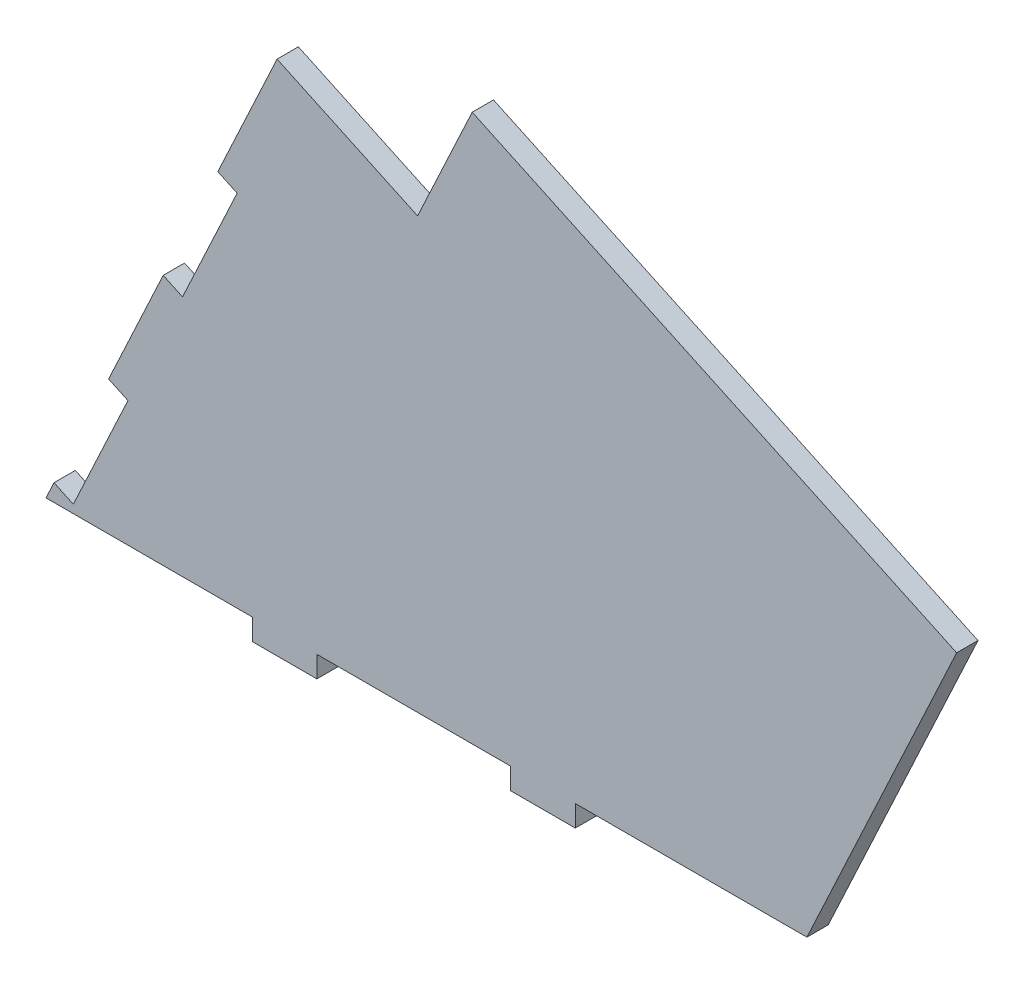
from build123d import *

# Parameters (mm, degrees)
BOSS_EXTRUDE1_DEPTH = 3.3
CUT_EXTRUDE1_DEPTH  = 3.3
SKETCH3_W           = 10
SKETCH3_H           = 3.3
BOSS_EXTRUDE2_DEPTH = 3.3


with BuildPart() as part:
    # Sketch1 → Boss-Extrude1 (new body)
    with BuildSketch(Plane.XY.offset(396.7)):
        Polygon((-321.546211223, 12.634626083), (-203.763939033, 12.634626088), (-180.579435923, 62.353953456), (-255.573677729, 97.324342727), (-264.026042964, 79.198186987), (-285.777429853, 89.341025269), align=None)
    extrude(amount=-BOSS_EXTRUDE1_DEPTH)

    # Sketch2 → Cut-Extrude1 (cut)
    with BuildSketch(Plane.XY.offset(396.7)):
        Polygon((-311.856397536, 33.414498593), (-320.308762771, 15.288342852), (-317.317947074, 13.893702588), (-308.865581839, 32.019858329), align=None)
        Polygon((-303.404032301, 51.540654333), (-294.951667066, 69.666810074), (-291.960851369, 68.27216981), (-300.413216604, 50.14601407), align=None)
    extrude(amount=-CUT_EXTRUDE1_DEPTH, mode=Mode.SUBTRACT)

    # Sketch3 → Boss-Extrude2 (add)
    with BuildSketch(Plane.XY.offset(396.7)):
        with Locations((-244.617848709, 10.984626083)):
            Rectangle(SKETCH3_W, SKETCH3_H)
        with Locations((-284.617848709, 10.984626083)):
            Rectangle(SKETCH3_W, SKETCH3_H)
    extrude(amount=-BOSS_EXTRUDE2_DEPTH)


solid = part.part
